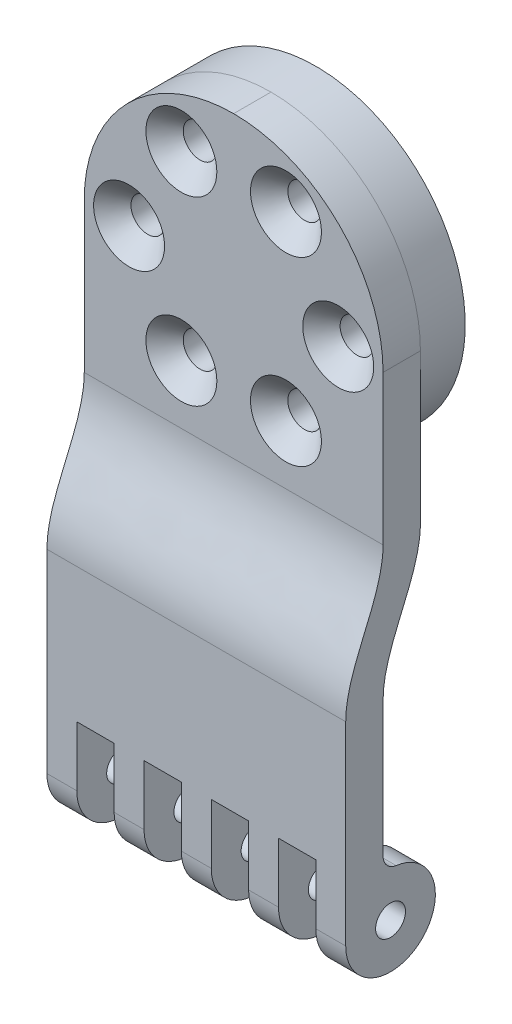
from build123d import *

# Parameters (mm, degrees)
SKETCH7_W           = 40
SKETCH7_H           = 40
BOSS_EXTRUDE1_DEPTH = 11
LOFT1_START         = -20
LOFT1_DEPTH         = 40
SKETCH16_W          = 49.026286786
SKETCH16_H          = 65.242270374
SKETCH16_R          = 20
CUT_EXTRUDE3_DEPTH  = 6
SKETCH17_W          = 40
SKETCH17_H          = 5
BOSS_EXTRUDE5_DEPTH = 18
SKETCH10_R          = 2.25
CUT_EXTRUDE1_DEPTH  = 25
SKETCH11_W          = 4
SKETCH11_H          = 5
BOSS_EXTRUDE3_DEPTH = 8
SKETCH14_R          = 6
BOSS_EXTRUDE4_DEPTH = 4
LPATTERN1_COUNT     = 5
LPATTERN1_PITCH     = 9
SKETCH15_R          = 2
CUT_EXTRUDE2_DEPTH  = 83.194890505
CHAMFER1_SIZE       = 2.5
FILLET2_R           = 2
FILLET3_R           = 20


# Read off the part's stored shape, not the designer's step: Loft1
with BuildPart() as part:
    # Sketch7 → Boss-Extrude1 (new body)
    with BuildSketch(Plane.XY):
        Rectangle(SKETCH7_W, SKETCH7_H)
    extrude(amount=BOSS_EXTRUDE1_DEPTH)

    # Loft1 outline → Loft1 (add)
    with BuildSketch(Plane.YZ.offset(LOFT1_START)):
        with BuildLine():
            add(Edge.make_bspline(
                [(-38, 16), (-31.772819436, 16), (-26.227180564, 11), (-20, 11)],
                knots=[0, 0, 0, 0, 1, 1, 1, 1], degree=3))
            Line((-38, 16), (-38, 11))
            add(Edge.make_bspline(
                [(-38, 11), (-31.772819436, 11), (-26.227180564, 6), (-20, 6)],
                knots=[0, 0, 0, 0, 1, 1, 1, 1], degree=3))
            Line((-20, 6), (-20, 11))
        make_face()
    extrude(amount=LOFT1_DEPTH)

    # Sketch16 → Cut-Extrude3 (cut)
    with BuildSketch(Plane(origin=(0, 0, 0), x_dir=(-1, 0, 0), z_dir=(0, 0, -1))):
        Rectangle(SKETCH16_W, SKETCH16_H)
        Circle(SKETCH16_R, mode=Mode.SUBTRACT)
    extrude(amount=-CUT_EXTRUDE3_DEPTH, mode=Mode.SUBTRACT)

    # Sketch17 → Boss-Extrude5 (add)
    with BuildSketch(Plane(origin=(0, -38, 0), x_dir=(-1, 0, 0), z_dir=(0, -1, 0))):
        with Locations((0, -13.5)):
            Rectangle(SKETCH17_W, SKETCH17_H)
    extrude(amount=BOSS_EXTRUDE5_DEPTH)

    # Sketch10 → Cut-Extrude1 (cut)
    with BuildSketch(Plane.XY.offset(11)):
        with Locations((-7.00009521, 12.124420806)):
            Circle(SKETCH10_R)
        with Locations((6.99990479, 12.124420806)):
            Circle(SKETCH10_R)
        with Locations((13.99990479, 6.5153e-05)):
            Circle(SKETCH10_R)
        with Locations((6.99990479, -12.1242905)):
            Circle(SKETCH10_R)
        with Locations((-7.00009521, -12.1242905)):
            Circle(SKETCH10_R)
        with Locations((-14.00009521, 6.5153e-05)):
            Circle(SKETCH10_R)
    extrude(amount=-CUT_EXTRUDE1_DEPTH, mode=Mode.SUBTRACT)

    # Sketch11 → Boss-Extrude3 (add)
    with BuildSketch(Plane(origin=(0, -56, -3.472963553), x_dir=(1, 0, 0), z_dir=(0, 1, 0))):
        with Locations((-18, -16.972963553)):
            Rectangle(SKETCH11_W, SKETCH11_H)
    boss_extrude3 = extrude(amount=-BOSS_EXTRUDE3_DEPTH)

    # Sketch14 → Boss-Extrude4 (add)
    with BuildSketch(Plane(origin=(-16, 0, 0), x_dir=(0, 0, -1), z_dir=(1, 0, 0))):
        with Locations((-10, -64)):
            Circle(SKETCH14_R)
    boss_extrude4 = extrude(amount=-BOSS_EXTRUDE4_DEPTH)

    # LPattern1: Boss-Extrude3, Boss-Extrude4 ×5
    with Locations(*[(i * LPATTERN1_PITCH, 0, 0) for i in range(1, LPATTERN1_COUNT)]):
        add(boss_extrude3)
        add(boss_extrude4)

    # Sketch15 → Cut-Extrude2 (cut, through all)
    with BuildSketch(Plane.ZY.offset(20)):
        with Locations(Location((10, -64, 0), (0, 0, 270))):
            Circle(SKETCH15_R)
    extrude(amount=-CUT_EXTRUDE2_DEPTH, mode=Mode.SUBTRACT)

    # Chamfer1
    chamfer1_edges = [part.edges().sort_by_distance(p)[0] for p in [
        (4.74990479, 12.124420806, 11),
        (-9.25009521, 12.124420806, 11),
        (-16.25009521, 6.5153e-05, 11),
        (-9.25009521, -12.1242905, 11),
        (4.74990479, -12.1242905, 11),
        (11.74990479, 6.5153e-05, 11),
    ]]
    chamfer(chamfer1_edges, length=CHAMFER1_SIZE)

    # Fillet2
    fillet2_edges = [part.edges().sort_by_distance(p)[0] for p in [
        (-18, -58.083920217, 11),
        (-9, -58.083920217, 11),
        (0, -58.083920217, 11),
        (9, -58.083920217, 11),
        (18, -58.083920217, 11),
    ]]
    fillet(fillet2_edges, radius=FILLET2_R)

    # Fillet3
    fillet3_edges = [part.edges().sort_by_distance(p)[0] for p in [
        (20, 20, 8.5),
        (-20, 20, 8.5),
    ]]
    fillet(fillet3_edges, radius=FILLET3_R - 0.0001)  # a hair under: the kernel refuses the full size


solid = part.part
